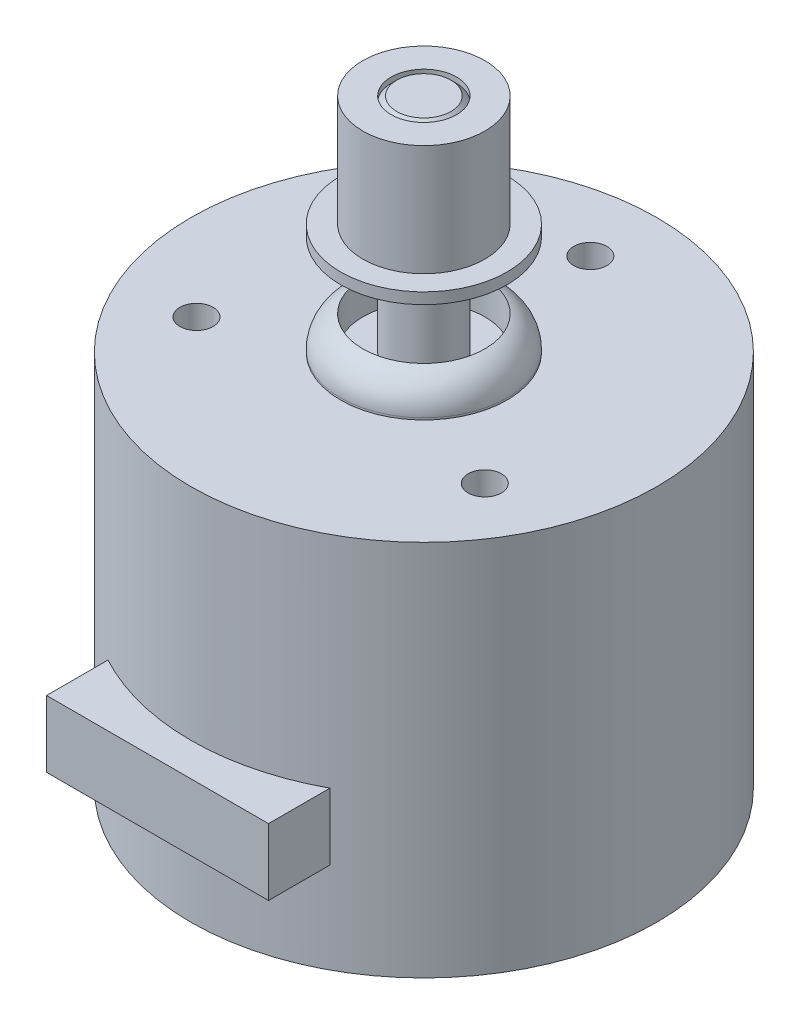
from build123d import *

# Parameters (mm, degrees)
SKETCH1_R           = 21
SKETCH1_R_2         = 1.5
SKETCH1_R_3         = 7.5
SKETCH1_R_4         = 5.5
SKETCH1_R_5         = 2.945
BOSS_EXTRUDE1_DEPTH = 17
CUT_EXTRUDE1_START  = 17
SKETCH1_3_R         = 1.5
CUT_EXTRUDE1_DEPTH  = 10
BOSS_EXTRUDE2_START = 17
SKETCH1_4_R         = 7.5
SKETCH1_4_R_2       = 5.5
BOSS_EXTRUDE2_DEPTH = 3
FILLET1_R           = 3
BOSS_EXTRUDE3_START = 17
SKETCH1_5_R         = 2.945
BOSS_EXTRUDE3_DEPTH = 20
BOSS_EXTRUDE4_START = -2.8
BOSS_EXTRUDE4_DEPTH = 6
CHAMFER1_SIZE       = 0.5
BOSS_EXTRUDE6_START = 27
SKETCH1_10_R        = 5.5
SKETCH1_10_R_2      = 2.945
BOSS_EXTRUDE6_DEPTH = 10
BOSS_EXTRUDE7_START = 26
SKETCH1_12_R        = 7.5
SKETCH1_12_R_2      = 5.5
SKETCH1_12_R_3      = 2.945
BOSS_EXTRUDE7_DEPTH = 1


with BuildPart() as part:
    # Sketch1 → Boss-Extrude1 (new, symmetric)
    # profile 1 of 7: a face of its own
    with BuildSketch(Plane(origin=(0, 0, 0), x_dir=(1, 0, 0), z_dir=(0, 1, 0))):
        with Locations(Location((0, 0, 0), (0, 0, 270))):
            Circle(SKETCH1_R)
        with Locations((12.990381057, -7.5)):
            Circle(SKETCH1_R_2, mode=Mode.SUBTRACT)
        with Locations((-12.990381057, -7.5)):
            Circle(SKETCH1_R_2, mode=Mode.SUBTRACT)
        with Locations((0, 15)):
            Circle(SKETCH1_R_2, mode=Mode.SUBTRACT)
        Circle(SKETCH1_R_3, mode=Mode.SUBTRACT)
    # profile 2 of 7: a face of its own
    with BuildSketch(Plane(origin=(0, 0, 0), x_dir=(1, 0, 0), z_dir=(0, 1, 0))):
        Circle(SKETCH1_R_3)
        Circle(SKETCH1_R_4, mode=Mode.SUBTRACT)
    # profile 3 of 7: a face of its own
    with BuildSketch(Plane(origin=(0, 0, 0), x_dir=(1, 0, 0), z_dir=(0, 1, 0))):
        Circle(SKETCH1_R_4)
        Circle(SKETCH1_R_5, mode=Mode.SUBTRACT)
    # profile 4 of 7: a face of its own
    with BuildSketch(Plane(origin=(0, 0, 0), x_dir=(1, 0, 0), z_dir=(0, 1, 0))):
        Circle(SKETCH1_R_5)
    # profile 5 of 7: a face of its own
    with BuildSketch(Plane(origin=(0, 0, 0), x_dir=(1, 0, 0), z_dir=(0, 1, 0))):
        with Locations((-12.990381057, -7.5)):
            Circle(SKETCH1_R_2)
    # profile 6 of 7: a face of its own
    with BuildSketch(Plane(origin=(0, 0, 0), x_dir=(1, 0, 0), z_dir=(0, 1, 0))):
        with Locations((12.990381057, -7.5)):
            Circle(SKETCH1_R_2)
    # profile 7 of 7: a face of its own
    with BuildSketch(Plane(origin=(0, 0, 0), x_dir=(1, 0, 0), z_dir=(0, 1, 0))):
        with Locations((0, 15)):
            Circle(SKETCH1_R_2)
    extrude(amount=BOSS_EXTRUDE1_DEPTH, both=True)

    # Sketch1<3> → Cut-Extrude1 (cut)
    with BuildSketch(Plane(origin=(0, 0, 0), x_dir=(1, 0, 0), z_dir=(0, 1, 0)).offset(CUT_EXTRUDE1_START)):
        with Locations(Location((-12.990381057, -7.5, 0), (0, 0, 270))):
            Circle(SKETCH1_3_R)
        with Locations(Location((12.990381057, -7.5, 0), (0, 0, 270))):
            Circle(SKETCH1_3_R)
        with Locations(Location((0, 15, 0), (0, 0, 270))):
            Circle(SKETCH1_3_R)
    extrude(amount=-CUT_EXTRUDE1_DEPTH, mode=Mode.SUBTRACT)

    # Sketch1<4> → Boss-Extrude2 (add)
    with BuildSketch(Plane(origin=(0, 0, 0), x_dir=(1, 0, 0), z_dir=(0, 1, 0)).offset(BOSS_EXTRUDE2_START)):
        with Locations(Location((0, 0, 0), (0, 0, 270))):
            Circle(SKETCH1_4_R)
        with Locations(Location((0, 0, 0), (0, 0, 270))):
            Circle(SKETCH1_4_R_2, mode=Mode.SUBTRACT)
    extrude(amount=BOSS_EXTRUDE2_DEPTH)

    # Fillet1
    # the kernel refuses this fillet: 3 mm, written as the material it takes off along each edge
    with BuildSketch(Plane(origin=(0, 20, 0), x_dir=(0, 0, 1), z_dir=(-1, 0, 0))) as fillet1_piece_1:
        with BuildLine():
            CenterArc((4.5, -2.828427125), FILLET1_R, 0, 70.528779366)
            Line((5.5, 0), (5.52, 0.056568542))
            ThreePointArc((5.52, 0.056568542), (6.5, 0.06), (7.5, 0.06))
            Line((7.5, 0.06), (7.56, 0))
            Line((7.56, 0), (7.56, -2.828427125))
            Line((7.56, -2.828427125), (7.5, -2.828427125))
        make_face()
    revolve(axis=Axis((0, 20, 0), (0, 1, 0)), mode=Mode.SUBTRACT)

    # Sketch1<5> → Boss-Extrude3 (add)
    with BuildSketch(Plane(origin=(0, 0, 0), x_dir=(1, 0, 0), z_dir=(0, 1, 0)).offset(BOSS_EXTRUDE3_START)):
        with Locations(Location((0, 0, 0), (0, 0, 270))):
            Circle(SKETCH1_5_R)
    extrude(amount=BOSS_EXTRUDE3_DEPTH)

    # Sketch1<8> → Boss-Extrude4 (add)
    with BuildSketch(Plane(origin=(0, 0, 0), x_dir=(1, 0, 0), z_dir=(0, 1, 0)).offset(BOSS_EXTRUDE4_START)):
        with BuildLine():
            ThreePointArc((10, -18.466185313), (0, -21), (-10, -18.466185313))
            Line((-10, -18.466185313), (-10, -24))
            Line((-10, -24), (10, -24))
            Line((10, -24), (10, -18.466185313))
        make_face()
    extrude(amount=-BOSS_EXTRUDE4_DEPTH)

    # Chamfer1
    chamfer1_edges = [part.edges().sort_by_distance(p)[0] for p in [
        (0, 37, -2.945),
    ]]
    chamfer(chamfer1_edges, length=CHAMFER1_SIZE)

    # Sketch1<10> → Boss-Extrude6 (add)
    with BuildSketch(Plane(origin=(0, 0, 0), x_dir=(1, 0, 0), z_dir=(0, 1, 0)).offset(BOSS_EXTRUDE6_START)):
        with Locations(Location((0, 0, 0), (0, 0, 270))):
            Circle(SKETCH1_10_R)
        with Locations(Location((0, 0, 0), (0, 0, 270))):
            Circle(SKETCH1_10_R_2, mode=Mode.SUBTRACT)
    extrude(amount=BOSS_EXTRUDE6_DEPTH)

    # Sketch1<12> → Boss-Extrude7 (add)
    # profile 1 of 2: a face of its own
    with BuildSketch(Plane(origin=(0, 0, 0), x_dir=(1, 0, 0), z_dir=(0, 1, 0)).offset(BOSS_EXTRUDE7_START)):
        with Locations(Location((0, 0, 0), (0, 0, 270))):
            Circle(SKETCH1_12_R)
        with Locations(Location((0, 0, 0), (0, 0, 270))):
            Circle(SKETCH1_12_R_2, mode=Mode.SUBTRACT)
    # profile 2 of 2: a face of its own
    with BuildSketch(Plane(origin=(0, 0, 0), x_dir=(1, 0, 0), z_dir=(0, 1, 0)).offset(BOSS_EXTRUDE7_START)):
        with Locations(Location((0, 0, 0), (0, 0, 270))):
            Circle(SKETCH1_12_R_2)
        with Locations(Location((0, 0, 0), (0, 0, 270))):
            Circle(SKETCH1_12_R_3, mode=Mode.SUBTRACT)
    extrude(amount=BOSS_EXTRUDE7_DEPTH)


solid = part.part
